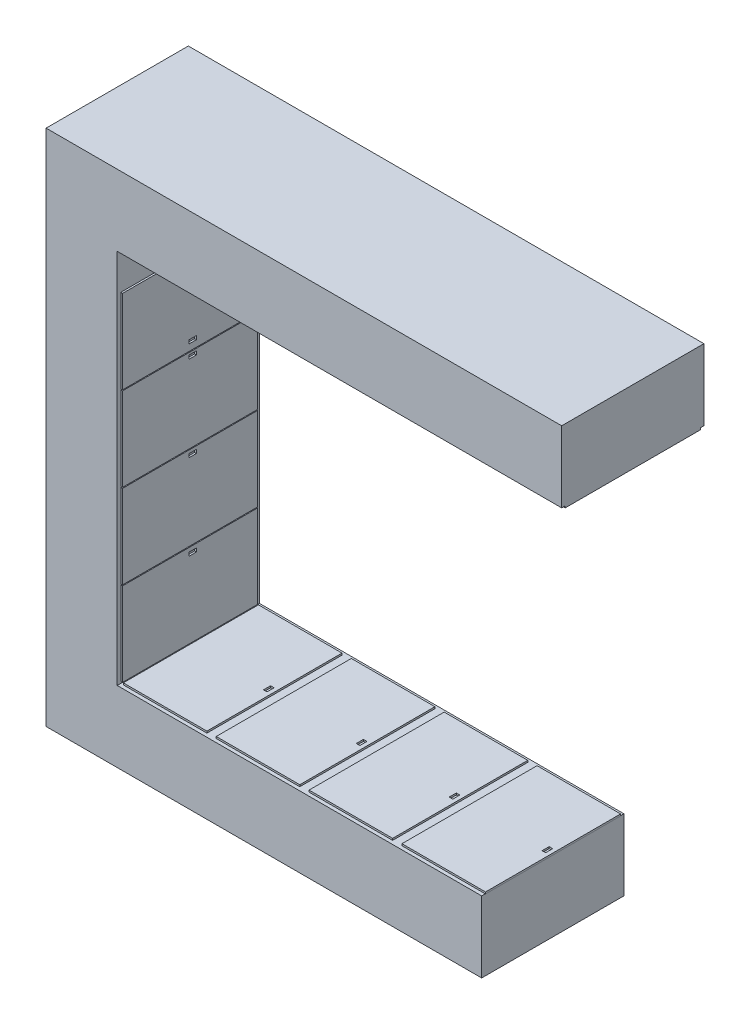
from build123d import *

# Parameters (mm, degrees)
BOSS_EXTRUDE1_DEPTH       = 800
SKETCH2_W                 = 470
SKETCH2_H                 = 760
SKETCH2_W_2               = 20
SKETCH2_H_2               = 40
BOSS_EXTRUDE2_DEPTH       = 10
SKETCH3_W                 = 760
SKETCH3_H                 = 470
SKETCH3_W_2               = 40
SKETCH3_H_2               = 20
BOSS_EXTRUDE3_DEPTH       = 10
BOSS_EXTRUDE4_OUTLINE_W   = 470
BOSS_EXTRUDE4_OUTLINE_H   = 760
BOSS_EXTRUDE4_OUTLINE_W_2 = 20
BOSS_EXTRUDE4_OUTLINE_H_2 = 40
BOSS_EXTRUDE4_OUTLINE_W_3 = 466.631060785
BOSS_EXTRUDE4_DEPTH       = 10


# Read off the part's stored shape, not the designer's step: Boss-Extrude4
with BuildPart() as part:
    # Sketch1 → Boss-Extrude1 (new body)
    with BuildSketch(Plane.XY):
        Polygon((2763.061970043, 160), (-136.938029957, 160), (-136.938029957, -2755), (2313.061970043, -2755), (2313.061970043, -2355), (263.061970043, -2355), (263.061970043, -240), (2763.061970043, -240), align=None)
    extrude(amount=BOSS_EXTRUDE1_DEPTH)

    # Sketch2 → Boss-Extrude2 (add)
    # profile 1 of 4: a face of its own
    with BuildSketch(Plane(origin=(0, -2355, 0), x_dir=(1, 0, 0), z_dir=(0, 1, 0))):
        with Locations((1034.900108644, -400)):
            Rectangle(SKETCH2_W, SKETCH2_H)
        with Locations((1237.987674913, -400)):
            Rectangle(SKETCH2_W_2, SKETCH2_H_2, mode=Mode.SUBTRACT)
    # profile 2 of 4: a face of its own
    with BuildSketch(Plane(origin=(0, -2355, 0), x_dir=(1, 0, 0), z_dir=(0, 1, 0))):
        with Locations((512.540108644, -400)):
            Rectangle(SKETCH2_W, SKETCH2_H)
        with Locations((715.627674913, -400)):
            Rectangle(SKETCH2_W_2, SKETCH2_H_2, mode=Mode.SUBTRACT)
    # profile 3 of 4: a face of its own
    with BuildSketch(Plane(origin=(0, -2355, 0), x_dir=(1, 0, 0), z_dir=(0, 1, 0))):
        with Locations((1557.260108644, -400)):
            Rectangle(SKETCH2_W, SKETCH2_H)
        with Locations((1760.347674913, -400)):
            Rectangle(SKETCH2_W_2, SKETCH2_H_2, mode=Mode.SUBTRACT)
    # profile 4 of 4: a face of its own
    with BuildSketch(Plane(origin=(0, -2355, 0), x_dir=(1, 0, 0), z_dir=(0, 1, 0))):
        with Locations((2079.620108644, -400)):
            Rectangle(SKETCH2_W, SKETCH2_H)
        with Locations((2282.707674913, -400)):
            Rectangle(SKETCH2_W_2, SKETCH2_H_2, mode=Mode.SUBTRACT)
    extrude(amount=BOSS_EXTRUDE2_DEPTH)

    # Sketch3 → Boss-Extrude3 (add)
    # profile 1 of 4: a face of its own
    with BuildSketch(Plane(origin=(263.061970043, 0, 0), x_dir=(0, 0, -1), z_dir=(1, 0, 0))):
        with Locations((-400, -1635)):
            Rectangle(SKETCH3_W, SKETCH3_H)
        with Locations((-385, -1427.588446785)):
            Rectangle(SKETCH3_W_2, SKETCH3_H_2, mode=Mode.SUBTRACT)
    # profile 2 of 4: a face of its own
    with BuildSketch(Plane(origin=(263.061970043, 0, 0), x_dir=(0, 0, -1), z_dir=(1, 0, 0))):
        with Locations((-400, -1160)):
            Rectangle(SKETCH3_W, SKETCH3_H)
        with Locations((-385, -947.588446785)):
            Rectangle(SKETCH3_W_2, SKETCH3_H_2, mode=Mode.SUBTRACT)
    # profile 3 of 4: a face of its own
    with BuildSketch(Plane(origin=(263.061970043, 0, 0), x_dir=(0, 0, -1), z_dir=(1, 0, 0))):
        with Locations((-400, -2110)):
            Rectangle(SKETCH3_W, SKETCH3_H)
        with Locations((-385, -1907.588446785)):
            Rectangle(SKETCH3_W_2, SKETCH3_H_2, mode=Mode.SUBTRACT)
    # profile 4 of 4: a face of its own
    with BuildSketch(Plane(origin=(263.061970043, 0, 0), x_dir=(0, 0, -1), z_dir=(1, 0, 0))):
        with Locations((-400, -685)):
            Rectangle(SKETCH3_W, SKETCH3_H)
        with Locations((-385, -873.244551229)):
            Rectangle(SKETCH3_W_2, SKETCH3_H_2, mode=Mode.SUBTRACT)
    extrude(amount=BOSS_EXTRUDE3_DEPTH)

    # Boss-Extrude4 outline → Boss-Extrude4 (add)
    # profile 1 of 5: a face of its own
    with BuildSketch(Plane.XZ.offset(240)):
        with Locations((531.430909258, 400)):
            Rectangle(BOSS_EXTRUDE4_OUTLINE_W, BOSS_EXTRUDE4_OUTLINE_H)
        with Locations((732.985950251, 454)):
            Rectangle(BOSS_EXTRUDE4_OUTLINE_W_2, BOSS_EXTRUDE4_OUTLINE_H_2, mode=Mode.SUBTRACT)
    # profile 2 of 5: a face of its own
    with BuildSketch(Plane.XZ.offset(240)):
        with Locations((1531.430909258, 400)):
            Rectangle(BOSS_EXTRUDE4_OUTLINE_W, BOSS_EXTRUDE4_OUTLINE_H)
        with Locations((1732.985950251, 454)):
            Rectangle(BOSS_EXTRUDE4_OUTLINE_W_2, BOSS_EXTRUDE4_OUTLINE_H_2, mode=Mode.SUBTRACT)
    # profile 3 of 5: a face of its own
    with BuildSketch(Plane.XZ.offset(240)):
        with Locations((2031.430909258, 400)):
            Rectangle(BOSS_EXTRUDE4_OUTLINE_W, BOSS_EXTRUDE4_OUTLINE_H)
        with Locations((2232.985950251, 454)):
            Rectangle(BOSS_EXTRUDE4_OUTLINE_W_2, BOSS_EXTRUDE4_OUTLINE_H_2, mode=Mode.SUBTRACT)
    # profile 4 of 5: a face of its own
    with BuildSketch(Plane.XZ.offset(240)):
        with Locations((2529.746439651, 400)):
            Rectangle(BOSS_EXTRUDE4_OUTLINE_W_3, BOSS_EXTRUDE4_OUTLINE_H)
        with Locations((2732.985950251, 454)):
            Rectangle(BOSS_EXTRUDE4_OUTLINE_W_2, BOSS_EXTRUDE4_OUTLINE_H_2, mode=Mode.SUBTRACT)
    # profile 5 of 5: a face of its own
    with BuildSketch(Plane.XZ.offset(240)):
        with Locations((1031.430909258, 400)):
            Rectangle(BOSS_EXTRUDE4_OUTLINE_W, BOSS_EXTRUDE4_OUTLINE_H)
        with Locations((1232.985950251, 454)):
            Rectangle(BOSS_EXTRUDE4_OUTLINE_W_2, BOSS_EXTRUDE4_OUTLINE_H_2, mode=Mode.SUBTRACT)
    extrude(amount=BOSS_EXTRUDE4_DEPTH)


solid = part.part
